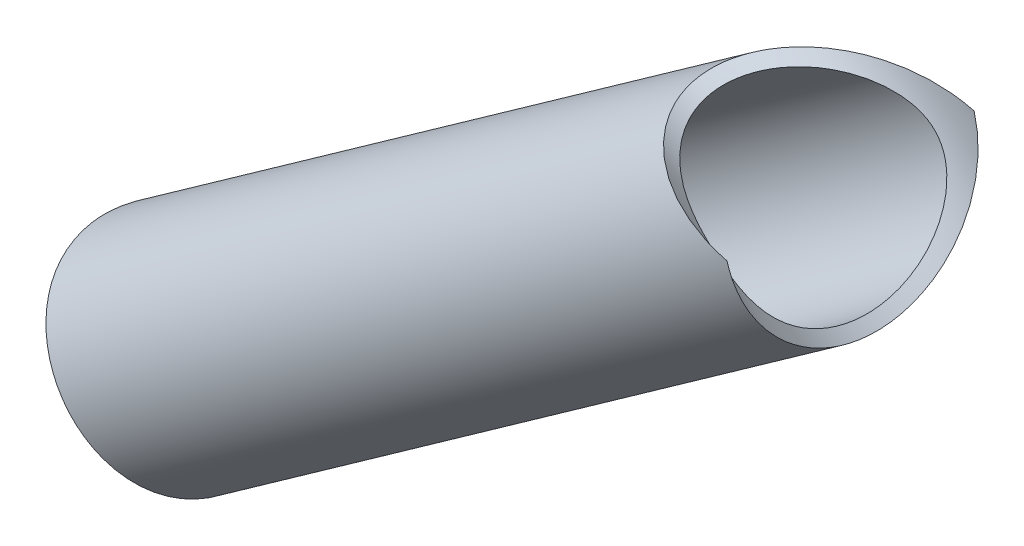
from build123d import *

# Parameters (mm, degrees)
BOSS_EXTRUDE1_OUTLINE_R   = 12.7
BOSS_EXTRUDE1_OUTLINE_R_2 = 11.049
BOSS_EXTRUDE1_DEPTH       = 169.483736402
BOSS_EXTRUDE1_START       = -1289
BOSS_EXTRUDE1_2_DEPTH     = 28
SKETCH3_R                 = 12.7


with BuildPart() as part:
    # Boss-Extrude1: read off the stored shape, not the designer's step
    # Boss-Extrude1 outline → Boss-Extrude1 (new body)
    with BuildSketch(Plane(origin=(147.844678818, 698.675090596, 1422.4), x_dir=(-0.21607186737585407, -0.17125420007266845, 0.961241357353179), z_dir=(-0.7444978184598123, -0.6080485419276475, -0.27568091875979095))):
        Circle(BOSS_EXTRUDE1_OUTLINE_R)
        Circle(BOSS_EXTRUDE1_OUTLINE_R_2, mode=Mode.SUBTRACT)
    extrude(amount=BOSS_EXTRUDE1_DEPTH)

    # Boss-Extrude1 2 outline → Boss-Extrude1 2 (cut)
    with BuildSketch(Plane(origin=(0, 0, 0), x_dir=(0.9999874538242801, -0.000724766866537943, 0.0049565014901968504), z_dir=(0.00500921091921221, 0.144685018294151, -0.98946508442046)).offset(BOSS_EXTRUDE1_START)):
        with BuildLine():
            Line((18, -799.36109198), (20.130666841, -798.335481217))
            ThreePointArc((20.130666841, -798.335481217), (30.42475196, -790.438302135), (36.700315808, -779.082646087))
            Line((36.700315808, -779.082646087), (37.342492978, -777))
            Line((37.342492978, -777), (18, -777))
            Line((18, -777), (18, -799.36109198))
        make_face()
    extrude(amount=BOSS_EXTRUDE1_2_DEPTH, mode=Mode.SUBTRACT)

    # Cut-Sweep1: sweep along a path in Sketch2
    with BuildLine(Plane.XY.offset(1422.4)) as cut_sweep1_path:
        ThreePointArc((175.5974564, 648.324959307), (147.844678818, 698.675090596), (93.95089657, 718.69539577))
    # Sketch3 → Cut-Sweep1 (sweep, cut)
    with BuildSketch(Plane(origin=(175.5974564, 648.324959307, 1422.4), x_dir=(0.9890558428813507, 0.14754165399052874, -1.0318371108759884e-15), z_dir=(-0.14754165399052874, 0.9890558428813507, -6.916992563193179e-15))):
        Circle(SKETCH3_R)
    sweep(path=cut_sweep1_path.line, mode=Mode.SUBTRACT)


solid = part.part
